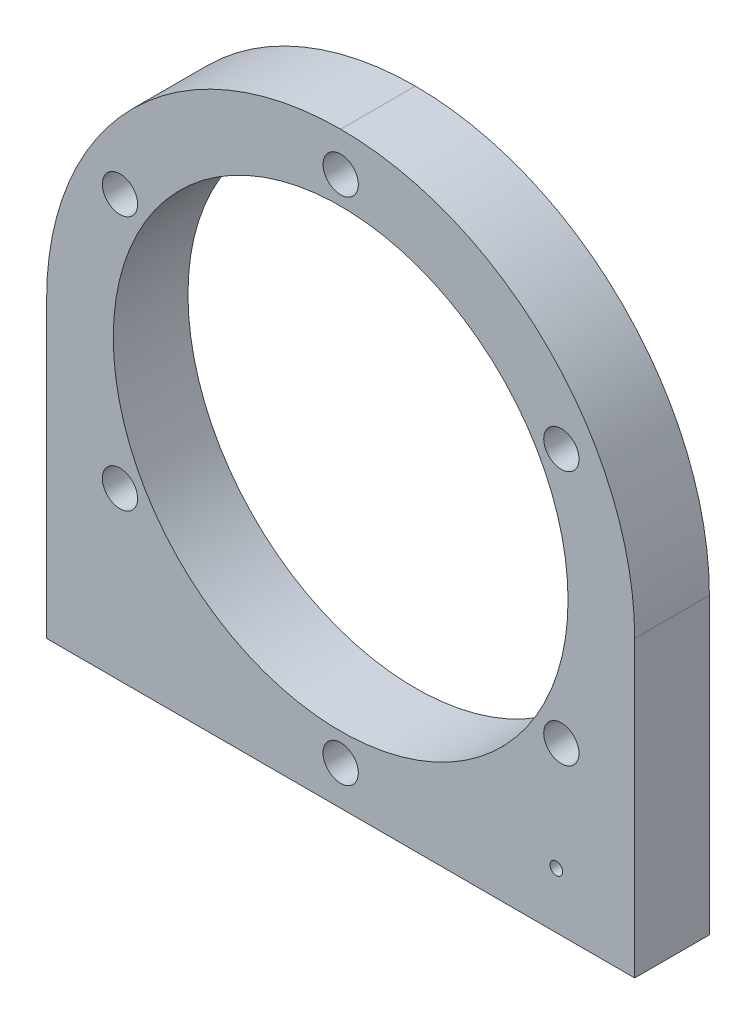
from build123d import *

# Parameters (mm, degrees)
SKETCH2_W                 = 75
SKETCH2_H                 = 75
BOSS_EXTRUDE1_DEPTH       = 4.7625
M4X0_7_TAPPED_HOLE1_D     = 3.3
M4X0_7_TAPPED_HOLE1_DEPTH = 15
M4X0_7_TAPPED_HOLE1_TIP   = 0.991420021
SKETCH6_R                 = 29
CUT_EXTRUDE1_DEPTH        = 54.881588924
M4_CLEARANCE_HOLE1_D      = 4.5
FILLET1_R                 = 37.5
M2X0_4_TAPPED_HOLE1_D     = 1.6


with BuildPart() as part:
    # Sketch2 → Boss-Extrude1 (new, symmetric)
    with BuildSketch(Plane.XY):
        Rectangle(SKETCH2_W, SKETCH2_H)
    extrude(amount=BOSS_EXTRUDE1_DEPTH, both=True)

    # M4x0.7 Tapped Hole1
    with Locations(Plane(origin=(0, -37.5, 0), x_dir=(-1, 0, 0), z_dir=(0, -1, 0))):
        with Locations((-32.5, 0), (-22.5, 0), (22.5, 0), (32.5, 0)):
            Hole(M4X0_7_TAPPED_HOLE1_D / 2, depth=M4X0_7_TAPPED_HOLE1_DEPTH)
            with Locations((0, 0, -(M4X0_7_TAPPED_HOLE1_DEPTH + M4X0_7_TAPPED_HOLE1_TIP / 2))):  # 118° drill point
                Cone(0, M4X0_7_TAPPED_HOLE1_D / 2, M4X0_7_TAPPED_HOLE1_TIP, mode=Mode.SUBTRACT)

    # Sketch6 → Cut-Extrude1 (cut, through all)
    with BuildSketch(Plane.XY.offset(4.7625)):
        Circle(SKETCH6_R)
    extrude(amount=-CUT_EXTRUDE1_DEPTH, mode=Mode.SUBTRACT)

    # M4 Clearance Hole1 (through all)
    with Locations(Plane(origin=(0, 0, -4.7625), x_dir=(-1, 0, 0), z_dir=(0, 0, -1))):
        with Locations((0, 32.5), (28.145825623, 16.25), (-28.145825623, 16.25), (-28.145825623, -16.25), (0, -32.5), (28.145825623, -16.25)):
            Hole(M4_CLEARANCE_HOLE1_D / 2)

    # Fillet1
    fillet1_edges = [part.edges().sort_by_distance(p)[0] for p in [
        (-37.5, 37.5, 0),
        (37.5, 37.5, 0),
    ]]
    fillet(fillet1_edges, radius=FILLET1_R - 0.0001)  # a hair under: the kernel refuses the full size

    # M2x0.4 Tapped Hole1 (through all)
    with Locations(Plane.XY.offset(4.7625)):
        with Locations((27.5, -30.38125)):
            Hole(M2X0_4_TAPPED_HOLE1_D / 2)


solid = part.part
